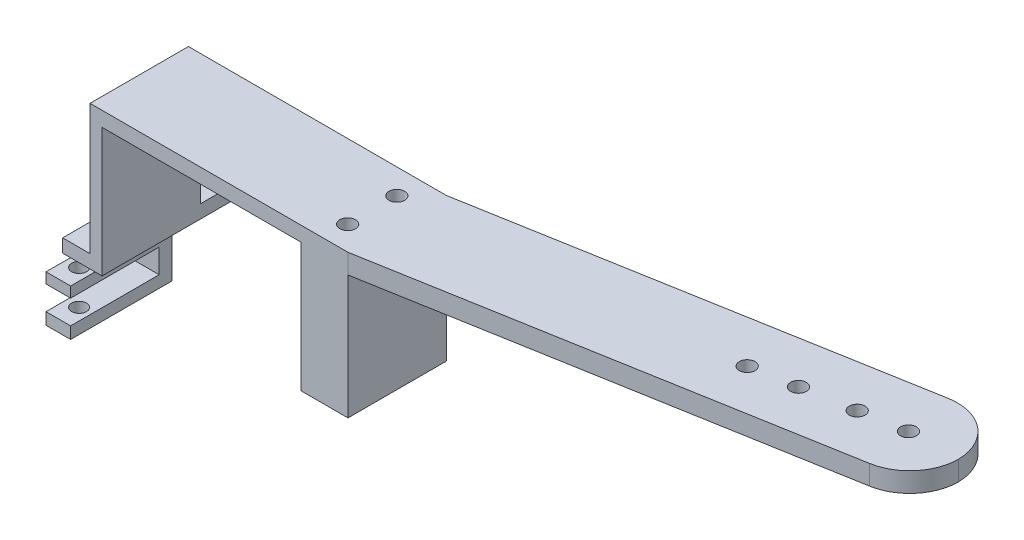
from build123d import *

# Parameters (mm, degrees)
SKETCH1_W                = 135
SKETCH1_H                = 20
BOSS_EXTRUDE1_DEPTH      = 3
BOSS_EXTRUDE2_START      = -20
BOSS_EXTRUDE2_DEPTH      = 20
SKETCH5_R                = 1.6
CUT_EXTRUDE1_DEPTH       = 5
BOSS_EXTRUDE3_DEPTH      = 2.7
SKETCH7_W                = 5
SKETCH7_H                = 2.576431393
BOSS_EXTRUDE4_DEPTH      = 20
SKETCH9_W                = 5
SKETCH9_H                = 2.400677448
SKETCH9_H_2              = 2.137863312
BOSS_EXTRUDE5_DEPTH      = 18
SKETCH10_R               = 1.51
CUT_EXTRUDE2_DEPTH       = 46
SKETCH11_W               = 87
SKETCH11_H               = 20
CUT_EXTRUDE3_DEPTH       = 7
BOSS_EXTRUDE7_DEPTH      = 26.162
BOSS_EXTRUDE7_DEPTH_BACK = 3
SKETCH12_W               = 9.518804698
SKETCH12_H               = 20
SKETCH13_R               = 1.6
CUT_EXTRUDE4_DEPTH       = 36.162
BOSS_EXTRUDE8_DEPTH      = 4
FILLET1_R                = 10
SKETCH18_R               = 1.6
CUT_EXTRUDE6_DEPTH       = 4


# Read off the part's stored shape, not the designer's step: Boss-Extrude2
with BuildPart() as part:
    # Sketch1 → Boss-Extrude1 (new body)
    with BuildSketch(Plane(origin=(0, 0, 0), x_dir=(1, 0, 0), z_dir=(0, 1, 0))):
        with Locations((67.5, 10)):
            Rectangle(SKETCH1_W, SKETCH1_H)
    extrude(amount=BOSS_EXTRUDE1_DEPTH)


with BuildPart() as body_2:
    # Boss-Extrude2 outline → Boss-Extrude2 (new body)
    with BuildSketch(Plane(origin=(0, 0, -20), x_dir=(-1, 0, 0), z_dir=(0, 0, -1)).offset(BOSS_EXTRUDE2_START)):
        Polygon((-135, 0), (0, 0), (0, -26.161397266), (8, -26.161397266), (8, -23.458863774), (2.440744198, -23.458863774), (2.440744198, 3), (-135, 3), align=None)
    extrude(amount=BOSS_EXTRUDE2_DEPTH)

    # Sketch5 → Cut-Extrude1 (cut)
    with BuildSketch(Plane(origin=(0, -26.161397266, 0), x_dir=(-1, 0, 0), z_dir=(0, -1, 0))):
        with Locations(Location((4.475005096, 14.904630263, 0), (0, 0, 90))):
            Circle(SKETCH5_R)
        with Locations(Location((4.475005096, 4.904630263, 0), (0, 0, 90))):
            Circle(SKETCH5_R)
    extrude(amount=-CUT_EXTRUDE1_DEPTH, mode=Mode.SUBTRACT)

    # Sketch6 → Boss-Extrude3 (add)
    with BuildSketch(Plane(origin=(0, -26.161397266, 0), x_dir=(-1, 0, 0), z_dir=(0, -1, 0))):
        Polygon((0, 26.189005721), (0, 20), (8, 20), (8, 23.612574328), (17, 23.612574328), (17, 26.189005721), align=None)
    extrude(amount=-BOSS_EXTRUDE3_DEPTH)

    # Sketch7 → Boss-Extrude4 (add)
    with BuildSketch(Plane.XZ.offset(26.161397266)):
        with Locations((-14.5, -24.900790025)):
            Rectangle(SKETCH7_W, SKETCH7_H)
    extrude(amount=BOSS_EXTRUDE4_DEPTH)

    # Sketch9 → Boss-Extrude5 (add)
    with BuildSketch(Plane.XY.offset(-23.612574328)):
        with Locations((-14.5, -44.961058542)):
            Rectangle(SKETCH9_W, SKETCH9_H)
        with Locations((-14.5, -37.813107102)):
            Rectangle(SKETCH9_W, SKETCH9_H_2)
    extrude(amount=BOSS_EXTRUDE5_DEPTH)

    # Sketch10 → Cut-Extrude2 (cut)
    with BuildSketch(Plane(origin=(0, -46.161397266, 0), x_dir=(-1, 0, 0), z_dir=(0, -1, 0))):
        with Locations(Location((14.400768804, 9.736347936, 0), (0, 0, 90))):
            Circle(SKETCH10_R)
    extrude(amount=-CUT_EXTRUDE2_DEPTH, mode=Mode.SUBTRACT)


with BuildPart() as cut_extrude3_tool:
    # Sketch11 → Cut-Extrude3 (new body)
    with BuildSketch(Plane.XZ):
        with Locations((91.5, -10)):
            Rectangle(SKETCH11_W, SKETCH11_H)
    extrude(amount=-CUT_EXTRUDE3_DEPTH)


with BuildPart() as part_1:
    add(part.part)

    # Cut-Extrude3: cut by cut_extrude3_tool
    add(cut_extrude3_tool.part, mode=Mode.SUBTRACT)



with BuildPart() as body_2_1:
    add(body_2.part)

    # Cut-Extrude3: cut by cut_extrude3_tool
    add(cut_extrude3_tool.part, mode=Mode.SUBTRACT)


with BuildPart() as part_2:
    add(part_1.part)

    add(body_2_1.part)  # Boss-Extrude7 merges body 2
    # Sketch12 → Boss-Extrude7 (add, two sides: drawn at the far end of the back side and taken through both)
    with BuildSketch(Plane(origin=(0, 0, 0), x_dir=(-1, 0, 0), z_dir=(0, -1, 0)).offset(-BOSS_EXTRUDE7_DEPTH_BACK)):
        with Locations((-45.240597651, 10)):
            Rectangle(SKETCH12_W, SKETCH12_H)
    extrude(amount=BOSS_EXTRUDE7_DEPTH + BOSS_EXTRUDE7_DEPTH_BACK)

    # Sketch13 → Cut-Extrude4 (cut)
    with BuildSketch(Plane(origin=(0, -26.162, 0), x_dir=(-1, 0, 0), z_dir=(0, -1, 0))):
        with Locations(Location((-45.024994904, 4.904630263, 0), (0, 0, 90))):
            Circle(SKETCH13_R)
        with Locations(Location((-45.024994904, 14.904630263, 0), (0, 0, 90))):
            Circle(SKETCH13_R)
    extrude(amount=-CUT_EXTRUDE4_DEPTH, mode=Mode.SUBTRACT)

    # Sketch14 → Boss-Extrude8 (add)
    with BuildSketch(Plane(origin=(0, 3, 0), x_dir=(1, 0, 0), z_dir=(0, 1, 0))):
        Polygon((50, 20), (50, 0), (148.480775301, 17.298817767), (148.480775301, 37.364817767), align=None)
    extrude(amount=-BOSS_EXTRUDE8_DEPTH)

    # Fillet1
    # the kernel refuses this fillet: 10 mm, written as the material it takes off along each edge
    with BuildSketch(Plane(origin=(148.480775301, 23.991341286, -17.298817767), x_dir=(-0.9849204245014849, 0, 0.1730079691800782), z_dir=(0, -1, 0))) as fillet1_piece_1:
        with BuildLine():
            CenterArc((FILLET1_R * 0.83965365145, FILLET1_R), FILLET1_R, 189.96275502, 80.03724498)
            Line((-FILLET1_R * 0.145266773052, FILLET1_R * 0.82699203082), (0, 0))
            Line((0, 0), (FILLET1_R * 0.83965365145, 0))
        make_face()
    extrude(amount=45.982682572, mode=Mode.SUBTRACT)
    with BuildSketch(Plane(origin=(148.480775301, 32.793839815, -37.364817767), x_dir=(0, 0, 1), z_dir=(0, -1, 0))) as fillet1_piece_2:
        with BuildLine():
            CenterArc((FILLET1_R * 1.19175359259, FILLET1_R), FILLET1_R, 170, 100)
            Line((FILLET1_R * 0.206945839582, FILLET1_R * 1.17364817767), (0, 0))
            Line((0, 0), (FILLET1_R * 1.19175359259, 0))
        make_face()
    extrude(amount=63.58767963, mode=Mode.SUBTRACT)

    # Sketch18 → Cut-Extrude6 (cut)
    with BuildSketch(Plane(origin=(0, 3, 0), x_dir=(1, 0, 0), z_dir=(0, 1, 0))):
        with Locations(Location((138.480775301, 25.447281841, 0), (0, 0, 270))):
            Circle(SKETCH18_R)
        with Locations(Location((119.473985668, 22.095872012, 0), (0, 0, 270))):
            Circle(SKETCH18_R)
        with Locations(Location((110.610715891, 20.533038413, 0), (0, 0, 270))):
            Circle(SKETCH18_R)
        with Locations(Location((129.617505524, 23.884448242, 0), (0, 0, 270))):
            Circle(SKETCH18_R)
    extrude(amount=-CUT_EXTRUDE6_DEPTH, mode=Mode.SUBTRACT)


solid = part_2.part
